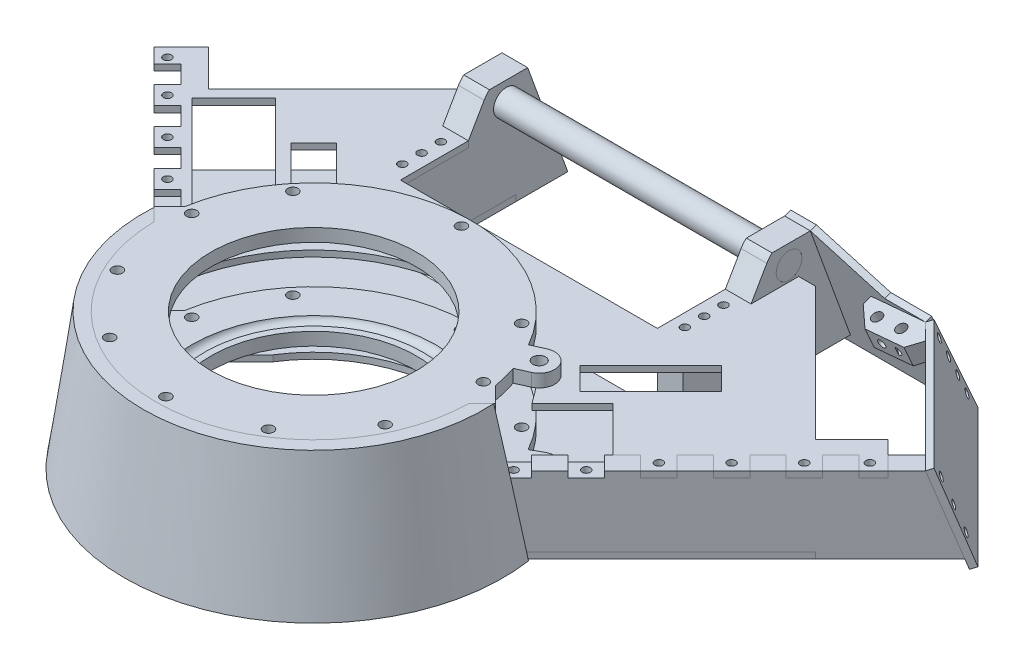
from build123d import *

# Parameters (mm, degrees)
BOSS_EXTRUDE1_DEPTH          = 3.0226
BOSS_EXTRUDE2_DEPTH          = 3.0226
BOSS_EXTRUDE3_START          = 25.4
SKETCH7_R                    = 50.8
BOSS_EXTRUDE3_DEPTH          = 6.35
SKETCH8_R                    = 3.2385
SKETCH10_R                   = 2.5527
CUT_EXTRUDE1_DEPTH           = 241.599746893
BOSS_EXTRUDE4_DEPTH          = 12.7
BOSS_EXTRUDE5_DEPTH          = 12.7
SKETCH15_R                   = 6.35
CUT_EXTRUDE3_DEPTH           = 299.282102198
SKETCH14_W                   = 12.7
SKETCH14_H                   = 23.53315537
CUT_EXTRUDE2_DEPTH           = 253.810534207
BOSS_EXTRUDE6_DEPTH          = 9.525
BOSS_EXTRUDE13_DEPTH         = 3.0226
CUT_EXTRUDE7_DEPTH           = 3.0226
RIGHT_START                  = -76.2
RIGHT_PLANE_MIRROR_OUTLINE_R = 6.35
RIGHT_PLANE_MIRROR_DEPTH     = 12.7
SKETCH17_R                   = 6.35
BOSS_EXTRUDE7_DEPTH          = 152.4
CUT_EXTRUDE5_DEPTH           = 279.131974533
SKETCH26_R                   = 3.175
BOSS_EXTRUDE11_DEPTH         = 6.35
BOSS_EXTRUDE8_DEPTH          = 3.175
BOSS_EXTRUDE9_DEPTH          = 3.175
CUT_EXTRUDE6_DEPTH           = 3.0226
SKETCH27_R                   = 3.175
BOSS_EXTRUDE12_DEPTH         = 6.35
SKETCH38_R                   = 2.4892
BOSS_EXTRUDE15_DEPTH         = 9.525
SKETCH31_R                   = 2.0193
CUT_EXTRUDE8_DEPTH           = 285.216235409
SKETCH33_R                   = 2.0193
CUT_EXTRUDE10_DEPTH          = 15.875
SKETCH32_R                   = 2.0193
CUT_EXTRUDE9_DEPTH           = 15.875
BOSS_EXTRUDE14_DEPTH         = 3.0226
LPATTERN1_COUNT              = 5
LPATTERN1_PITCH              = 25.4
CUT_EXTRUDE11_DEPTH          = 3.0226
CUT_EXTRUDE12_DEPTH          = 290.877928978
CUT_EXTRUDE12_DEPTH_BACK     = 290.877928978


# Read off the part's stored shape, not the designer's step: Right Plane Mirror
with BuildPart() as part:
    # Sketch3 → Boss-Extrude1 (new body)
    with BuildSketch(Plane(origin=(0, -38.1, 0), x_dir=(1, 0, 0), z_dir=(0, 1, 0))):
        with BuildLine():
            Line((84.414407538, 5.388153673), (163.497678721, 84.471424855))
            Line((163.497678721, 84.471424855), (84.471424855, 163.497678721))
            Line((84.471424855, 163.497678721), (63.5, 163.497678721))
            Line((63.5, 163.497678721), (63.5, 106.3625))
            Line((63.5, 106.3625), (-63.5, 106.3625))
            Line((-63.5, 106.3625), (-63.5, 163.497678721))
            Line((-63.5, 163.497678721), (-84.471424855, 163.497678721))
            Line((-84.471424855, 163.497678721), (-163.497678721, 84.471424855))
            Line((-163.497678721, 84.471424855), (-84.414407538, 5.388153673))
            Line((-84.414407538, 5.388153673), (-55.004068742, 34.798492469))
            ThreePointArc((-55.004068742, 34.798492469), (0, 65.0875), (55.004068742, 34.798492469))
            Line((55.004068742, 34.798492469), (84.414407538, 5.388153673))
        make_face()
    extrude(amount=-BOSS_EXTRUDE1_DEPTH)


with BuildPart() as body_2:
    # Sketch6 → Boss-Extrude2 (new body)
    with BuildSketch(Plane(origin=(0, -6.35, 0), x_dir=(1, 0, 0), z_dir=(0, 1, 0))):
        with BuildLine():
            Line((84.414407538, 5.388153673), (163.497678721, 84.471424855))
            Line((163.497678721, 84.471424855), (84.471424855, 163.497678721))
            Line((84.471424855, 163.497678721), (63.5, 163.497678721))
            Line((63.5, 163.497678721), (63.5, 106.3625))
            Line((63.5, 106.3625), (-63.5, 106.3625))
            Line((-63.5, 106.3625), (-63.5, 163.497678721))
            Line((-63.5, 163.497678721), (-84.471424855, 163.497678721))
            Line((-84.471424855, 163.497678721), (-163.497678721, 84.471424855))
            Line((-163.497678721, 84.471424855), (-84.414407538, 5.388153673))
            Line((-84.414407538, 5.388153673), (-55.004068742, 34.798492469))
            ThreePointArc((-55.004068742, 34.798492469), (0, 65.0875), (55.004068742, 34.798492469))
            Line((55.004068742, 34.798492469), (84.414407538, 5.388153673))
        make_face()
    extrude(amount=BOSS_EXTRUDE2_DEPTH)


with BuildPart() as body_3:
    # Sketch7 → Boss-Extrude3 (new body)
    with BuildSketch(Plane(origin=(0, 0, 0), x_dir=(1, 0, 0), z_dir=(0, 1, 0)).offset(BOSS_EXTRUDE3_START)):
        with BuildLine():
            Line((-77.777475589, -1.248778276), (-84.414407538, 5.388153673))
            Line((-84.414407538, 5.388153673), (-76.671118158, 13.131443053))
            ThreePointArc((-76.671118158, 13.131443053), (0, 77.7875), (76.671118158, 13.131443053))
            Line((76.671118158, 13.131443053), (84.414407538, 5.388153673))
            Line((84.414407538, 5.388153673), (77.777475589, -1.248778276))
            ThreePointArc((77.777475589, -1.248778276), (0, -77.7875), (-77.777475589, -1.248778276))
        make_face()
        with Locations(Location((0, 0, 0), (0, 0, 270))):
            Circle(SKETCH7_R, mode=Mode.SUBTRACT)
    extrude(amount=-BOSS_EXTRUDE3_DEPTH)

    # Sketch8 → Cut-Revolve1 (revolve, cut)
    with BuildSketch(Plane(origin=(0, 0, 0), x_dir=(0, 0, -1), z_dir=(1, 0, 0))):
        with Locations((57.15, 18.415)):
            Circle(SKETCH8_R)
    revolve(axis=Axis((0, 0, 0), (0, 1, 0)), mode=Mode.SUBTRACT)


with BuildPart() as cut_extrude1_tool:
    # Sketch10 → Cut-Extrude1 (new, through all)
    with BuildSketch(Plane(origin=(0, 25.4, 0), x_dir=(1, 0, 0), z_dir=(0, 1, 0))):
        with Locations(Location((0, -73.025, 0), (0, 0, 270))):
            Circle(SKETCH10_R)
        with Locations(Location((39.2363039, -61.58866033, 0), (0, 0, 270))):
            Circle(SKETCH10_R)
        with Locations(Location((66.183126148, -30.861698564, 0), (0, 0, 270))):
            Circle(SKETCH10_R)
        with Locations(Location((72.06940717, 11.775023363, 0), (0, 0, 270))):
            Circle(SKETCH10_R)
        with Locations(Location((0, 73.025, 0), (0, 0, 270))):
            Circle(SKETCH10_R)
        with Locations(Location((56.526425763, 46.232172948, 0), (0, 0, 270))):
            Circle(SKETCH10_R)
        with Locations(Location((-56.526425763, 46.232172948, 0), (0, 0, 90))):
            Circle(SKETCH10_R)
        with Locations(Location((-72.06940717, 11.775023363, 0), (0, 0, 270))):
            Circle(SKETCH10_R)
        with Locations(Location((-66.183126148, -30.861698564, 0), (0, 0, 270))):
            Circle(SKETCH10_R)
        with Locations(Location((-39.2363039, -61.58866033, 0), (0, 0, 270))):
            Circle(SKETCH10_R)
    extrude(amount=-CUT_EXTRUDE1_DEPTH)


with BuildPart() as part_1:
    add(part.part)

    # Cut-Extrude1: cut by cut_extrude1_tool
    add(cut_extrude1_tool.part, mode=Mode.SUBTRACT)


with BuildPart() as body_2_1:
    add(body_2.part)

    # Cut-Extrude1: cut by cut_extrude1_tool
    add(cut_extrude1_tool.part, mode=Mode.SUBTRACT)

    # Sketch14 → Cut-Extrude2 (cut, through all)
    with BuildSketch(Plane(origin=(0, -3.3274, 0), x_dir=(1, 0, 0), z_dir=(0, 1, 0))):
        with Locations((69.85, 151.731101036)):
            Rectangle(SKETCH14_W, SKETCH14_H)
        with Locations((-69.85, 151.731101036)):
            Rectangle(SKETCH14_W, SKETCH14_H)
    extrude(amount=-CUT_EXTRUDE2_DEPTH, mode=Mode.SUBTRACT)

    # Sketch29 → Boss-Extrude13 (add)
    with BuildSketch(Plane(origin=(0, -3.3274, 0), x_dir=(1, 0, 0), z_dir=(0, 1, 0))):
        Polygon((163.497678721, 84.471424855), (181.458190963, 102.431937098), (174.722998872, 109.167129188), (167.987806781, 115.902321279), (150.027294539, 97.941809037), align=None)
        Polygon((-150.027294539, 97.941809037), (-167.987806781, 115.902321279), (-174.722998872, 109.167129188), (-181.458190963, 102.431937098), (-163.497678721, 84.471424855), align=None)
    extrude(amount=-BOSS_EXTRUDE13_DEPTH)

    # Sketch19 → Cut-Extrude5 (cut, through all)
    with BuildSketch(Plane(origin=(0, -3.3274, 0), x_dir=(1, 0, 0), z_dir=(0, 1, 0))):
        with BuildLine():
            Line((-76.83696795, 12.123345763), (76.83696795, 12.123345763))
            ThreePointArc((76.83696795, 12.123345763), (0, 77.7875), (-76.83696795, 12.123345763))
        make_face()
    extrude(amount=-CUT_EXTRUDE5_DEPTH, mode=Mode.SUBTRACT)

    # Sketch28 → Cut-Extrude6 (cut)
    with BuildSketch(Plane(origin=(0, -3.3274, 0), x_dir=(1, 0, 0), z_dir=(0, 1, 0))):
        Polygon((77.679215447, 12.123345763), (106.759430598, 41.203560915), (84.736589898, 63.226401615), (64.697429354, 43.18724107), (76.671118158, 13.131443053), align=None)
        Polygon((71.423536976, 60.198216824), (60.198216824, 71.423536976), (95.228286764, 106.453606916), (106.453606916, 95.228286764), align=None)
        Polygon((-106.453606916, 95.228286764), (-95.228286764, 106.453606916), (-60.198216824, 71.423536976), (-71.423536976, 60.198216824), align=None)
        Polygon((-129.393918664, 110.492954403), (-150.048507743, 89.838365325), (-98.861047853, 38.650905435), (-78.206458774, 59.305494513), align=None)
    extrude(amount=-CUT_EXTRUDE6_DEPTH, mode=Mode.SUBTRACT)


with BuildPart() as body_3_1:
    add(body_3.part)

    # Cut-Extrude1: cut by cut_extrude1_tool
    add(cut_extrude1_tool.part, mode=Mode.SUBTRACT)


with BuildPart() as body_4:
    # Sketch11 → Boss-Extrude4 (new body)
    with BuildSketch(Plane.ZY.offset(-63.5)):
        Polygon((-163.497678721, -38.1), (-163.497678721, -41.1226), (-189.085161015, -41.1226), (-175.328833217, -3.3274), (-163.497678721, -3.3274), (-163.497678721, -6.35), (-106.3625, -6.35), (-106.3625, -38.1), align=None)
    extrude(amount=-BOSS_EXTRUDE4_DEPTH)

    # Sketch12 → Boss-Extrude5 (add)
    with BuildSketch(Plane.ZY.offset(-63.5)):
        with BuildLine():
            Line((-163.497678721, -3.3274), (-175.328833217, -3.3274))
            Line((-175.328833217, -3.3274), (-169.264215585, 13.335))
            Line((-169.264215585, 13.335), (-150.349739587, 13.335))
            ThreePointArc((-150.349739587, 13.335), (-148.921553932, 11.853111828), (-147.751477372, 10.16))
            Line((-147.751477372, 10.16), (-139.964523351, -3.3274))
            Line((-139.964523351, -3.3274), (-139.964523351, -6.35))
            Line((-139.964523351, -6.35), (-163.497678721, -6.35))
            Line((-163.497678721, -6.35), (-163.497678721, -3.3274))
        make_face()
    extrude(amount=-BOSS_EXTRUDE5_DEPTH)

    # Sketch15 → Cut-Extrude3 (cut, through all)
    with BuildSketch(Plane.ZY.offset(-63.5)):
        with Locations((-158.75, 3.81)):
            Circle(SKETCH15_R)
    extrude(amount=-CUT_EXTRUDE3_DEPTH, mode=Mode.SUBTRACT)


with BuildPart() as body_5:
    # Sketch16 → Boss-Extrude6 (new body)
    with BuildSketch(Plane(origin=(39.513126933, 0, 39.513126933), x_dir=(0.7071067811865476, 0, -0.7071067811865476), z_dir=(0.7071067811865476, 0, 0.7071067811865476))):
        Polygon((63.5, -6.35), (175.340634664, -6.35), (175.340634664, -3.3274), (213.82696788, -3.3274), (227.583295678, -41.1226), (175.340634664, -41.1226), (175.340634664, -38.1), (63.5, -38.1), align=None)
    extrude(amount=-BOSS_EXTRUDE6_DEPTH)

    # Sketch30 → Cut-Extrude7 (cut)
    with BuildSketch(Plane(origin=(0, -3.3274, 0), x_dir=(1, 0, 0), z_dir=(0, 1, 0))):
        Polygon((163.497678721, 84.471424855), (156.76248663, 91.206616946), (174.722998872, 109.167129188), (181.458190963, 102.431937098), align=None)
    extrude(amount=-CUT_EXTRUDE7_DEPTH, mode=Mode.SUBTRACT)


with BuildPart() as body_6:
    # Top Plane Mirror: mirrored copy
    add(body_3_1.part.mirror(Plane.ZX))

    # Sketch26 → Boss-Extrude11 (add)
    with BuildSketch(Plane(origin=(0, -19.05, 0), x_dir=(1, 0, 0), z_dir=(0, 1, 0))):
        with BuildLine():
            Line((67.724588003, 38.265850783), (73.065779528, 41.283739026))
            ThreePointArc((73.065779528, 41.283739026), (81.481081438, 40.673220145), (84.174625829, 32.677292547))
            Line((84.174625829, 32.677292547), (84.151678315, 32.591651259))
            Line((84.151678315, 32.591651259), (91.149599629, 25.593729945))
            Line((91.149599629, 25.593729945), (76.948678164, 11.39280848))
            ThreePointArc((76.948678164, 11.39280848), (73.573966771, 25.254040662), (67.724588003, 38.265850783))
        make_face()
        with Locations(Location((76.814271033, 34.649493671, 0), (0, 0, 270))):
            Circle(SKETCH26_R, mode=Mode.SUBTRACT)
    extrude(amount=-BOSS_EXTRUDE11_DEPTH)


with BuildPart() as body_7:
    # Right Plane Mirror outline → Right Plane Mirror (new body)
    with BuildSketch(Plane.YZ.offset(RIGHT_START)):
        with BuildLine():
            Line((-6.35, -106.3625), (-38.1, -106.3625))
            Line((-38.1, -106.3625), (-38.1, -163.497678721))
            Line((-38.1, -163.497678721), (-41.1226, -163.497678721))
            Line((-41.1226, -163.497678721), (-41.1226, -189.085161015))
            Line((-41.1226, -189.085161015), (13.335, -169.264215585))
            Line((13.335, -169.264215585), (13.335, -150.349739587))
            ThreePointArc((13.335, -150.349739587), (11.853111828, -148.921553932), (10.16, -147.751477372))
            Line((10.16, -147.751477372), (-3.3274, -139.964523351))
            Line((-3.3274, -139.964523351), (-6.35, -139.964523351))
            Line((-6.35, -139.964523351), (-6.35, -106.3625))
        make_face()
        with Locations((3.81, -158.75)):
            Circle(RIGHT_PLANE_MIRROR_OUTLINE_R, mode=Mode.SUBTRACT)
    extrude(amount=RIGHT_PLANE_MIRROR_DEPTH)


with BuildPart() as body_8:
    # Sketch17 → Boss-Extrude7 (new body)
    with BuildSketch(Plane(origin=(76.2, 0, 0), x_dir=(0, 0, -1), z_dir=(1, 0, 0))):
        with Locations(Location((158.75, 3.81, 0), (0, 0, 180))):
            Circle(SKETCH17_R)
    extrude(amount=-BOSS_EXTRUDE7_DEPTH)


with BuildPart() as body_9:
    # Sketch22 → Boss-Extrude8 (new body)
    with BuildSketch(Plane(origin=(0, 55.960368946, -153.749850064), x_dir=(-1, 0, 0), z_dir=(0, 0.3420201433256732, -0.9396926207859068))):
        Polygon((-63.5, -103.313537639), (-63.5, -45.360970176), (-76.2, -45.360970176), (-106.912301808, -63.092725892), (-127.068164761, -63.092725892), (-132.766222303, -103.313537639), (-133.431579726, -108.010088253), (-63.5, -108.010088253), align=None)
    extrude(amount=BOSS_EXTRUDE8_DEPTH)


with BuildPart() as body_10:
    # Sketch24 → Boss-Extrude9 (new body)
    with BuildSketch(Plane(origin=(132.755450418, 68.333430925, -132.755450418), x_dir=(-0.590791677085232, -0.3040991697893342, -0.7473211419599053), z_dir=(0.6644630243886736, 0.34202014332567315, -0.6644630243886738))):
        Polygon((-13.658183812, -132.740153927), (-28.194141955, -90.239855549), (56.967989273, -61.11269122), (77.52493842, -101.553689392), align=None)
    extrude(amount=BOSS_EXTRUDE9_DEPTH)


with BuildPart() as body_3_2:
    add(body_3_1.part)

    # Sketch27 → Boss-Extrude12 (add)
    with BuildSketch(Plane(origin=(0, 25.4, 0), x_dir=(1, 0, 0), z_dir=(0, 1, 0))):
        with BuildLine():
            Line((79.947495483, 27.703465702), (73.699559572, 24.885137637))
            Line((73.699559572, 24.885137637), (67.433110671, 38.777193575))
            Line((67.433110671, 38.777193575), (73.681046582, 41.595521639))
            ThreePointArc((73.681046582, 41.595521639), (83.760299002, 37.782718121), (79.947495483, 27.703465702))
        make_face()
        with Locations(Location((76.814271033, 34.649493671, 0), (0, 0, 270))):
            Circle(SKETCH27_R, mode=Mode.SUBTRACT)
    extrude(amount=-BOSS_EXTRUDE12_DEPTH)


with BuildPart() as body_11:
    # Sketch38 → Boss-Extrude15 (new body)
    with BuildSketch(Plane(origin=(11.262550912, -74.704469207, -27.190203158), x_dir=(0.9901134653195894, 0.1318095212475, 0.047974742326969286), z_dir=(-0.14026876271228123, 0.9304023171015812, 0.33863874931728466))):
        Polygon((124.023499968, 157.224965876), (116.961962346, 163.61717296), (88.386962346, 163.61717296), (88.386962346, 159.50534787), (97.874408456, 150.91717296), (118.313593611, 150.91717296), align=None)
        with Locations(Location((97.911962346, 157.26717296, 0), (0, 0, 270))):
            Circle(SKETCH38_R, mode=Mode.SUBTRACT)
        with Locations(Location((110.611962346, 157.26717296, 0), (0, 0, 270))):
            Circle(SKETCH38_R, mode=Mode.SUBTRACT)
    extrude(amount=-BOSS_EXTRUDE15_DEPTH)


with BuildPart() as cut_extrude8_tool:
    # Sketch31 → Cut-Extrude8 (new, through all)
    with BuildSketch(Plane(origin=(0, -3.3274, 0), x_dir=(1, 0, 0), z_dir=(0, 1, 0))):
        with Locations(Location((85.536939553, 13.245877779, 0), (0, 0, 90))):
            Circle(SKETCH31_R)
        with Locations(Location((103.497451795, 31.206390021, 0), (0, 0, 90))):
            Circle(SKETCH31_R)
        with Locations(Location((121.457964037, 49.166902263, 0), (0, 0, 90))):
            Circle(SKETCH31_R)
        with Locations(Location((139.41847628, 67.127414505, 0), (0, 0, 90))):
            Circle(SKETCH31_R)
        with Locations(Location((157.378988522, 85.087926747, 0), (0, 0, 90))):
            Circle(SKETCH31_R)
        with Locations(Location((164.620210736, 92.329148961, 0), (0, 0, 270))):
            Circle(SKETCH31_R)
        with Locations(Location((173.600466857, 101.309405082, 0), (0, 0, 270))):
            Circle(SKETCH31_R)
        with Locations(Location((69.85, 113.638511676, 0), (0, 0, 90))):
            Circle(SKETCH31_R)
        with Locations(Location((69.85, 123.163511676, 0), (0, 0, 90))):
            Circle(SKETCH31_R)
        with Locations(Location((69.85, 132.688511676, 0), (0, 0, 90))):
            Circle(SKETCH31_R)
    cut_extrude8 = extrude(amount=-CUT_EXTRUDE8_DEPTH)


with BuildPart() as part_2:
    add(part_1.part)

    # Cut-Extrude8: cut by cut_extrude8_tool
    add(cut_extrude8_tool.part, mode=Mode.SUBTRACT)


with BuildPart() as body_2_2:
    add(body_2_1.part)

    # Cut-Extrude8: cut by cut_extrude8_tool
    add(cut_extrude8_tool.part, mode=Mode.SUBTRACT)


with BuildPart() as body_4_1:
    add(body_4.part)

    # Cut-Extrude8: cut by cut_extrude8_tool
    add(cut_extrude8_tool.part, mode=Mode.SUBTRACT)


with BuildPart() as body_5_1:
    add(body_5.part)

    # Cut-Extrude8: cut by cut_extrude8_tool
    add(cut_extrude8_tool.part, mode=Mode.SUBTRACT)


with BuildPart() as cut_extrude10_tool:
    # Sketch33 → Cut-Extrude10 (new body)
    with BuildSketch(Plane(origin=(0, 57.046282901, -156.733374135), x_dir=(-1, 0, 0), z_dir=(0, 0.3420201433256691, -0.9396926207859082))):
        with Locations(Location((-69.85, -95.310088253, 0), (0, 0, 90))):
            Circle(SKETCH33_R)
        with Locations(Location((-69.85, -85.785088253, 0), (0, 0, 90))):
            Circle(SKETCH33_R)
        with Locations(Location((-69.85, -76.260088253, 0), (0, 0, 90))):
            Circle(SKETCH33_R)
        with Locations(Location((-69.85, -66.735088253, 0), (0, 0, 90))):
            Circle(SKETCH33_R)
        with Locations(Location((-115.161753734, -69.589554557, 0), (0, 0, 90))):
            Circle(SKETCH33_R)
        with Locations(Location((-116.497813698, -79.020385315, 0), (0, 0, 90))):
            Circle(SKETCH33_R)
        with Locations(Location((-117.833873663, -88.451216072, 0), (0, 0, 90))):
            Circle(SKETCH33_R)
        with Locations(Location((-119.169933628, -97.882046829, 0), (0, 0, 90))):
            Circle(SKETCH33_R)
    cut_extrude10 = extrude(amount=-CUT_EXTRUDE10_DEPTH)


with BuildPart() as body_4_2:
    add(body_4_1.part)

    # Cut-Extrude10: cut by cut_extrude10_tool
    add(cut_extrude10_tool.part, mode=Mode.SUBTRACT)


with BuildPart() as body_9_1:
    add(body_9.part)

    # Cut-Extrude10: cut by cut_extrude10_tool
    add(cut_extrude10_tool.part, mode=Mode.SUBTRACT)


with BuildPart() as body_11_1:
    add(body_11.part)

    # Cut-Extrude10: cut by cut_extrude10_tool
    add(cut_extrude10_tool.part, mode=Mode.SUBTRACT)


with BuildPart() as cut_extrude9_tool:
    # Sketch32 → Cut-Extrude9 (new body)
    with BuildSketch(Plane(origin=(134.865120521, 69.41934488, -134.865120521), x_dir=(-0.5907916770852318, -0.30409916978933427, -0.7473211419599053), z_dir=(0.6644630243886736, 0.34202014332567293, -0.6644630243886738))):
        with Locations(Location((-21.289795744, -95.710278279, 0), (0, 0, 18.881721231))):
            Circle(SKETCH32_R)
        with Locations(Location((-17.179877915, -107.726874113, 0), (0, 0, 18.881721231))):
            Circle(SKETCH32_R)
        with Locations(Location((-13.069960085, -119.743469947, 0), (0, 0, 18.881721231))):
            Circle(SKETCH32_R)
        with Locations(Location((67.828951464, -92.989168641, 0), (0, 0, 18.881721231))):
            Circle(SKETCH32_R)
        with Locations(Location((63.512822953, -84.498193451, 0), (0, 0, 18.881721231))):
            Circle(SKETCH32_R)
        with Locations(Location((59.196694443, -76.007218261, 0), (0, 0, 18.881721231))):
            Circle(SKETCH32_R)
        with Locations(Location((54.880565933, -67.516243071, 0), (0, 0, 18.881721231))):
            Circle(SKETCH32_R)
    cut_extrude9 = extrude(amount=-CUT_EXTRUDE9_DEPTH)


with BuildPart() as body_5_2:
    add(body_5_1.part)

    # Cut-Extrude9: cut by cut_extrude9_tool
    add(cut_extrude9_tool.part, mode=Mode.SUBTRACT)

    # Sketch34 → Boss-Extrude14 (add)
    with BuildSketch(Plane(origin=(0, -6.35, 0), x_dir=(1, 0, 0), z_dir=(0, 1, 0))):
        Polygon((86.659471568, 21.103601885), (95.639727689, 30.083858006), (102.37491978, 23.348665915), (93.394663659, 14.368409794), align=None)
    boss_extrude14 = extrude(amount=BOSS_EXTRUDE14_DEPTH)

    # LPattern1: Boss-Extrude14 ×5
    with Locations(*[Vector(0.7071067811865475, 0, -0.7071067811865476) * (i * LPATTERN1_PITCH) for i in range(1, LPATTERN1_COUNT)]):
        add(boss_extrude14)


with BuildPart() as body_10_1:
    add(body_10.part)

    # Cut-Extrude9: cut by cut_extrude9_tool
    add(cut_extrude9_tool.part, mode=Mode.SUBTRACT)


with BuildPart() as body_11_2:
    add(body_11_1.part)

    # Cut-Extrude9: cut by cut_extrude9_tool
    add(cut_extrude9_tool.part, mode=Mode.SUBTRACT)


with BuildPart() as mirror1_tool:
    # Mirror1: Cut-Extrude8, Cut-Extrude10, Cut-Extrude9 across plane
    add(cut_extrude8.mirror(Plane(origin=(0, 0, 0), x_dir=(0, 0, 1), z_dir=(1, 0, 0))))
    add(cut_extrude10.mirror(Plane(origin=(0, 0, 0), x_dir=(0, 0, 1), z_dir=(1, 0, 0))))
    add(cut_extrude9.mirror(Plane(origin=(0, 0, 0), x_dir=(0, 0, 1), z_dir=(1, 0, 0))))


with BuildPart() as part_3:
    add(part_2.part)

    # Mirror1: cut by mirror1_tool
    add(mirror1_tool.part, mode=Mode.SUBTRACT)


with BuildPart() as body_2_3:
    add(body_2_2.part)

    # Mirror1: cut by mirror1_tool
    add(mirror1_tool.part, mode=Mode.SUBTRACT)

    # Sketch36 → Cut-Extrude11 (cut)
    with BuildSketch(Plane(origin=(0, -3.3274, 0), x_dir=(1, 0, 0), z_dir=(0, 1, 0))):
        Polygon((167.481776658, 101.925906974), (158.501520537, 92.945650853), (165.236712628, 86.210458762), (174.216968749, 95.190714883), align=None)
        Polygon((149.521264416, 83.965394732), (140.541008295, 74.985138611), (147.276200386, 68.24994652), (156.256456507, 77.230202641), align=None)
        Polygon((131.560752174, 66.00488249), (122.580496053, 57.024626369), (129.315688143, 50.289434278), (138.295944264, 59.269690399), align=None)
        Polygon((113.600239932, 48.044370248), (104.61998381, 39.064114127), (111.355175901, 32.328922036), (120.335432022, 41.309178157), align=None)
        Polygon((95.639727689, 30.083858006), (86.659471568, 21.103601885), (93.394663659, 14.368409794), (102.37491978, 23.348665915), align=None)
        Polygon((-174.216968749, 95.190714883), (-167.481776658, 101.925906974), (-158.501520537, 92.945650853), (-165.236712628, 86.210458762), align=None)
        Polygon((-156.256456507, 77.230202641), (-149.521264416, 83.965394732), (-140.541008295, 74.985138611), (-147.276200386, 68.24994652), align=None)
        Polygon((-138.295944264, 59.269690399), (-131.560752174, 66.00488249), (-122.580496053, 57.024626369), (-129.315688143, 50.289434278), align=None)
        Polygon((-120.335432022, 41.309178157), (-113.600239932, 48.044370248), (-104.61998381, 39.064114127), (-111.355175901, 32.328922036), align=None)
        Polygon((-102.37491978, 23.348665915), (-95.639727689, 30.083858006), (-86.659471568, 21.103601885), (-93.394663659, 14.368409794), align=None)
    extrude(amount=-CUT_EXTRUDE11_DEPTH, mode=Mode.SUBTRACT)


with BuildPart() as body_7_1:
    add(body_7.part)

    # Mirror1: cut by mirror1_tool
    add(mirror1_tool.part, mode=Mode.SUBTRACT)


with BuildPart() as cut_extrude11_kept_piece:
    # of the separate pieces the step leaves, the one the design keeps (cut_extrude11_pieces_kept)
    add(body_2_3.part.solids().sort_by_distance((-84.414407538, -6.35, -5.388153673))[0])


with BuildPart() as body_12:
    # Sketch40 → Revolve1 (revolve)
    with BuildSketch(Plane(origin=(0, 0, 0), x_dir=(0, 0, -1), z_dir=(1, 0, 0)), mode=Mode.PRIVATE) as revolve1_sk:
        Polygon((-77.7875, -19.05), (-77.7875, -41.91), (-93.597303584, -41.91), (-84.1375, 25.4), (-77.7875, 25.4), (-77.7875, 19.05), (-65.0875, 19.05), (-65.0875, -19.05), align=None)
    revolve(revolve1_sk.sketch.rotate(Axis((0, 0, 0), (0, 1, 0)), 180), axis=Axis((0, 0, 0), (0, 1, 0)))

    # Sketch41 → Cut-Extrude12 (cut, two sides: drawn at the far end of the back side and taken through both)
    with BuildSketch(Plane(origin=(0, 25.4, 0), x_dir=(1, 0, 0), z_dir=(0, 1, 0)).offset(-CUT_EXTRUDE12_DEPTH_BACK)):
        with BuildLine():
            Line((-92.606821653, 13.580567788), (-28.226253865, -50.8))
            Line((-28.226253865, -50.8), (28.226253865, -50.8))
            Line((28.226253865, -50.8), (92.606821653, 13.580567788))
            ThreePointArc((92.606821653, 13.580567788), (0, 93.597303584), (-92.606821653, 13.580567788))
        make_face()
    extrude(amount=CUT_EXTRUDE12_DEPTH + CUT_EXTRUDE12_DEPTH_BACK, mode=Mode.SUBTRACT)


solid = Compound([body_6.part, body_8.part, body_3_2.part, body_4_2.part, body_9_1.part, body_5_2.part, body_10_1.part, body_11_2.part, part_3.part, body_7_1.part, cut_extrude11_kept_piece.part, body_12.part])
